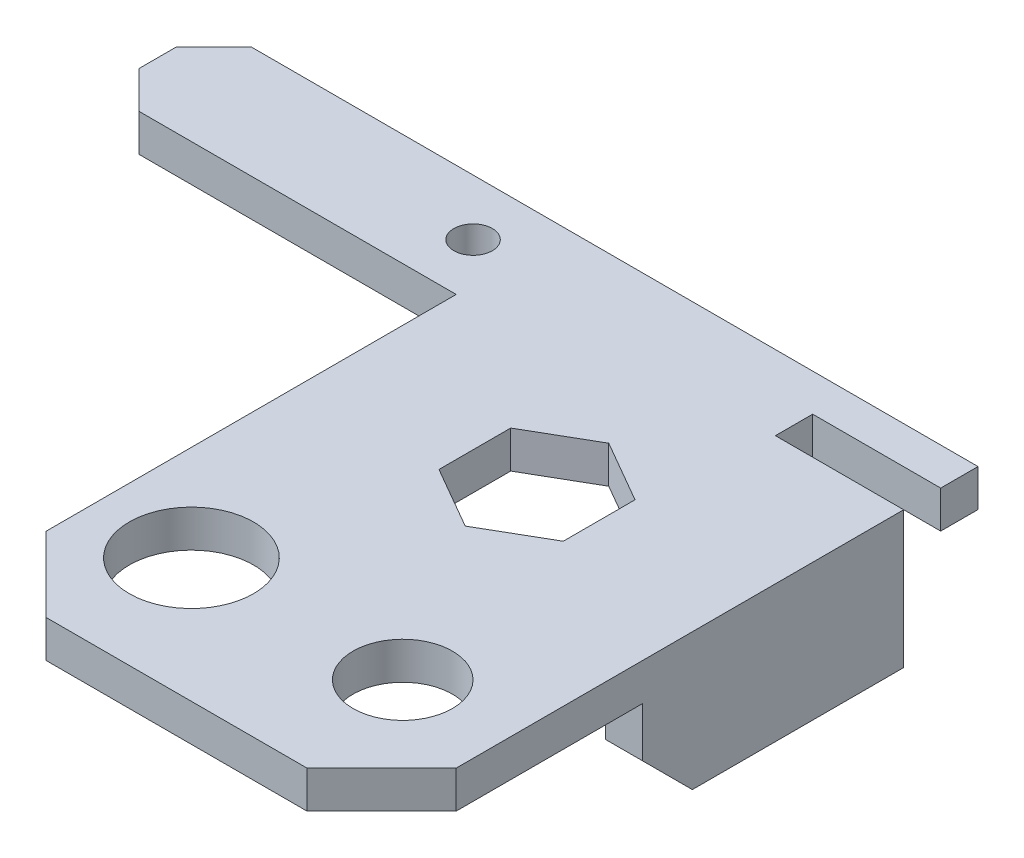
from build123d import *

# Parameters (mm, degrees)
CROQUIS1_R              = 5
CROQUIS1_R_2            = 4
SALIENTE_EXTRUIR1_DEPTH = 3
SALIENTE_EXTRUIR2_DEPTH = 3
CROQUIS3_W              = 10.32
CROQUIS3_H              = 3
CORTAR_EXTRUIR1_DEPTH   = 3
SALIENTE_EXTRUIR3_DEPTH = 8
CROQUIS11_W             = 3
CROQUIS11_H             = 21
SALIENTE_EXTRUIR6_DEPTH = 8
CORTAR_EXTRUIR3_DEPTH   = 51.960769225
SALIENTE_EXTRUIR5_DEPTH = 3
CORTAR_EXTRUIR4_DEPTH   = 3
CROQUIS10_R             = 1.55
CORTAR_EXTRUIR5_DEPTH   = 3


with BuildPart() as part:
    # Croquis1 → Saliente-Extruir1 (new body)
    with BuildSketch(Plane(origin=(0, 0, 0), x_dir=(1, 0, 0), z_dir=(0, 1, 0))):
        Polygon((0, 35), (25.301087099, 35), (25.301087099, -4), (19.301087099, -10), (-1.698912901, -10), (-7.698912901, -4), (-7.698912901, 35), align=None)
        Circle(CROQUIS1_R, mode=Mode.SUBTRACT)
        with Locations((17, 0)):
            Circle(CROQUIS1_R_2, mode=Mode.SUBTRACT)
    extrude(amount=SALIENTE_EXTRUIR1_DEPTH)

    # Croquis2 → Saliente-Extruir2 (add)
    with BuildSketch(Plane(origin=(0, 3, 0), x_dir=(1, 0, 0), z_dir=(0, 1, 0))):
        Polygon((-7.698912901, 38), (-7.698912901, 29), (-33.198912901, 29), (-36.198912901, 32), (-36.198912901, 35), (-33.198912901, 38), align=None)
    extrude(amount=-SALIENTE_EXTRUIR2_DEPTH)

    # Croquis3 → Cortar-Extruir1 (cut)
    with BuildSketch(Plane(origin=(0, 3, 0), x_dir=(1, 0, 0), z_dir=(0, 1, 0))):
        with Locations((20.141087099, 33.5)):
            Rectangle(CROQUIS3_W, CROQUIS3_H)
    extrude(amount=-CORTAR_EXTRUIR1_DEPTH, mode=Mode.SUBTRACT)

    # Croquis5 → Saliente-Extruir3 (add)
    with BuildSketch(Plane.XZ):
        Polygon((-7.698912901, -29), (-7.698912901, -11), (-4.698912901, -11), (-4.698912901, -29), (-4.698912901, -32), (-7.698912901, -32), align=None)
    extrude(amount=SALIENTE_EXTRUIR3_DEPTH)

    # Croquis11 → Saliente-Extruir6 (add)
    with BuildSketch(Plane.XZ):
        with Locations((23.801087099, -21.5)):
            Rectangle(CROQUIS11_W, CROQUIS11_H)
    extrude(amount=SALIENTE_EXTRUIR6_DEPTH)

    # Croquis7 → Cortar-Extruir3 (cut, through all)
    with BuildSketch(Plane.ZY.offset(7.698912901)):
        Polygon((-11, -8), (-15, -8), (-11, -4), align=None)
    extrude(amount=-CORTAR_EXTRUIR3_DEPTH, mode=Mode.SUBTRACT)

    # Croquis8 → Saliente-Extruir5 (add)
    with BuildSketch(Plane(origin=(0, 3, 0), x_dir=(1, 0, 0), z_dir=(0, 1, 0))):
        Polygon((14.981087099, 35), (25.281087099, 35), (25.281087099, 38), (-7.698912901, 38), (-7.698912901, 35), align=None)
    extrude(amount=-SALIENTE_EXTRUIR5_DEPTH)

    # Croquis9 → Cortar-Extruir4 (cut)
    with BuildSketch(Plane(origin=(0, 3, 0), x_dir=(1, 0, 0), z_dir=(0, 1, 0))):
        Polygon((8.801087099, 13.226497308), (13.801087099, 16.113248654), (13.801087099, 21.886751346), (8.801087099, 24.773502692), (3.801087099, 21.886751346), (3.801087099, 16.113248654), align=None)
    extrude(amount=-CORTAR_EXTRUIR4_DEPTH, mode=Mode.SUBTRACT)

    # Croquis10 → Cortar-Extruir5 (cut)
    with BuildSketch(Plane(origin=(0, 3, 0), x_dir=(1, 0, 0), z_dir=(0, 1, 0))):
        with Locations((-10.838912901, 33.5)):
            Circle(CROQUIS10_R)
    extrude(amount=-CORTAR_EXTRUIR5_DEPTH, mode=Mode.SUBTRACT)


solid = part.part
